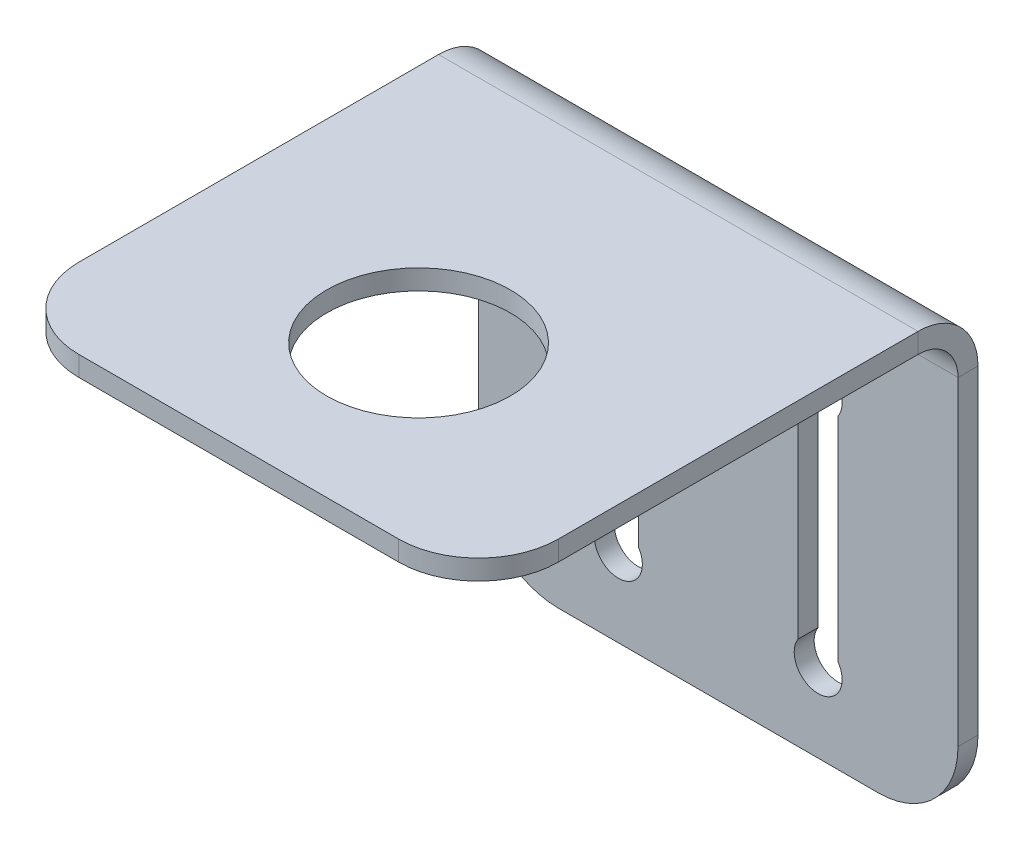
from build123d import *

# Parameters (mm, degrees)
SKETCH2_W              = 60
SKETCH2_H              = 60
BOSS_EXTRUDE1_DEPTH    = 5
SKETCH3_W              = 60
SKETCH3_H              = 5
BOSS_EXTRUDE2_DEPTH    = 60
CUT_EXTRUDE1_REACH     = 106.163
SKETCH4_R              = 11.5
CUT_EXTRUDE2_REACH     = 105.923
CONVERT_SOLID1_DEPTH   = 60
CONVERT_SOLID1_2_DEPTH = 60
FILLET1_R              = 10
FILLET2_R              = 10
FILLET3_R              = 10
FILLET4_R              = 10


# Read off the part's stored shape, not the designer's step: Convert-Solid1
with BuildPart() as part:
    # Sketch2 → Boss-Extrude1 (new body)
    with BuildSketch(Plane.XY):
        with Locations((30, 30)):
            Rectangle(SKETCH2_W, SKETCH2_H)
    extrude(amount=BOSS_EXTRUDE1_DEPTH)

    # Sketch3 → Boss-Extrude2 (add)
    with BuildSketch(Plane.XY.offset(5)):
        with Locations((30, 57.5)):
            Rectangle(SKETCH3_W, SKETCH3_H)
    extrude(amount=BOSS_EXTRUDE2_DEPTH)

    # Sketch4 → Cut-Extrude1 (cut, up to next)
    with BuildSketch(Plane.XZ.offset(-55), mode=Mode.PRIVATE) as cut_extrude1_sk1:
        with Locations(Location((30, 42.5, 0), (0, 0, 270))):
            Circle(SKETCH4_R)
    cut_extrude1_tool1 = extrude(cut_extrude1_sk1.sketch, amount=-CUT_EXTRUDE1_REACH, mode=Mode.PRIVATE) & part.part
    add(cut_extrude1_tool1.solids().sort_by_distance((30, 55, 42.5))[0], mode=Mode.SUBTRACT)

    # Sketch5 → Cut-Extrude2 (cut, up to next)
    with BuildSketch(Plane.XY.offset(5), mode=Mode.PRIVATE) as cut_extrude2_sk1:
        with BuildLine():
            Line((15, 38.341687605), (15, 11.658312395))
            ThreePointArc((15, 11.658312395), (17.5, 7), (20, 11.658312395))
            Line((20, 11.658312395), (20, 38.341687605))
            ThreePointArc((20, 38.341687605), (17.5, 43), (15, 38.341687605))
        make_face()
    cut_extrude2_tool1 = extrude(cut_extrude2_sk1.sketch, amount=-CUT_EXTRUDE2_REACH, mode=Mode.PRIVATE) & part.part
    # Sketch5 → Cut-Extrude2 (cut, up to next)
    with BuildSketch(Plane.XY.offset(5), mode=Mode.PRIVATE) as cut_extrude2_sk2:
        with BuildLine():
            Line((40, 38.341687605), (40, 11.658312395))
            ThreePointArc((40, 11.658312395), (42.5, 7), (45, 11.658312395))
            Line((45, 11.658312395), (45, 38.341687605))
            ThreePointArc((45, 38.341687605), (42.5, 43), (40, 38.341687605))
        make_face()
    cut_extrude2_tool2 = extrude(cut_extrude2_sk2.sketch, amount=-CUT_EXTRUDE2_REACH, mode=Mode.PRIVATE) & part.part
    add(cut_extrude2_tool1.solids().sort_by_distance((17.5, 25, 5))[0], mode=Mode.SUBTRACT)
    add(cut_extrude2_tool2.solids().sort_by_distance((42.5, 25, 5))[0], mode=Mode.SUBTRACT)

    # Convert-Solid1 outline → Convert-Solid1 (cut)
    with BuildSketch(Plane.YZ):
        with BuildLine():
            Line((60, 65), (57.5, 65))
            Line((57.5, 65), (57.5, 10))
            ThreePointArc((57.5, 10), (55.303300859, 4.696699141), (50, 2.5))
            Line((50, 2.5), (0, 2.5))
            Line((0, 2.5), (0, 0))
            Line((0, 0), (60, 0))
            Line((60, 0), (60, 65))
        make_face()
    extrude(amount=CONVERT_SOLID1_DEPTH, mode=Mode.SUBTRACT)

    # Convert-Solid1 2 outline → Convert-Solid1 2 (add)
    with BuildSketch(Plane.YZ):
        with BuildLine():
            Line((55, 5), (55, 10))
            ThreePointArc((55, 10), (53.535533906, 6.464466094), (50, 5))
            Line((50, 5), (55, 5))
        make_face()
    extrude(amount=CONVERT_SOLID1_2_DEPTH)

    # Fillet1
    fillet1_edges = [part.edges().sort_by_distance(p)[0] for p in [
        (60, 56.25, 65),
    ]]
    fillet(fillet1_edges, radius=FILLET1_R)

    # Fillet2
    fillet2_edges = [part.edges().sort_by_distance(p)[0] for p in [
        (0, 56.25, 65),
    ]]
    fillet(fillet2_edges, radius=FILLET2_R)

    # Fillet3
    fillet3_edges = [part.edges().sort_by_distance(p)[0] for p in [
        (0, 0, 3.75),
    ]]
    fillet(fillet3_edges, radius=FILLET3_R)

    # Fillet4
    fillet4_edges = [part.edges().sort_by_distance(p)[0] for p in [
        (60, 0, 3.75),
    ]]
    fillet(fillet4_edges, radius=FILLET4_R)


solid = part.part
